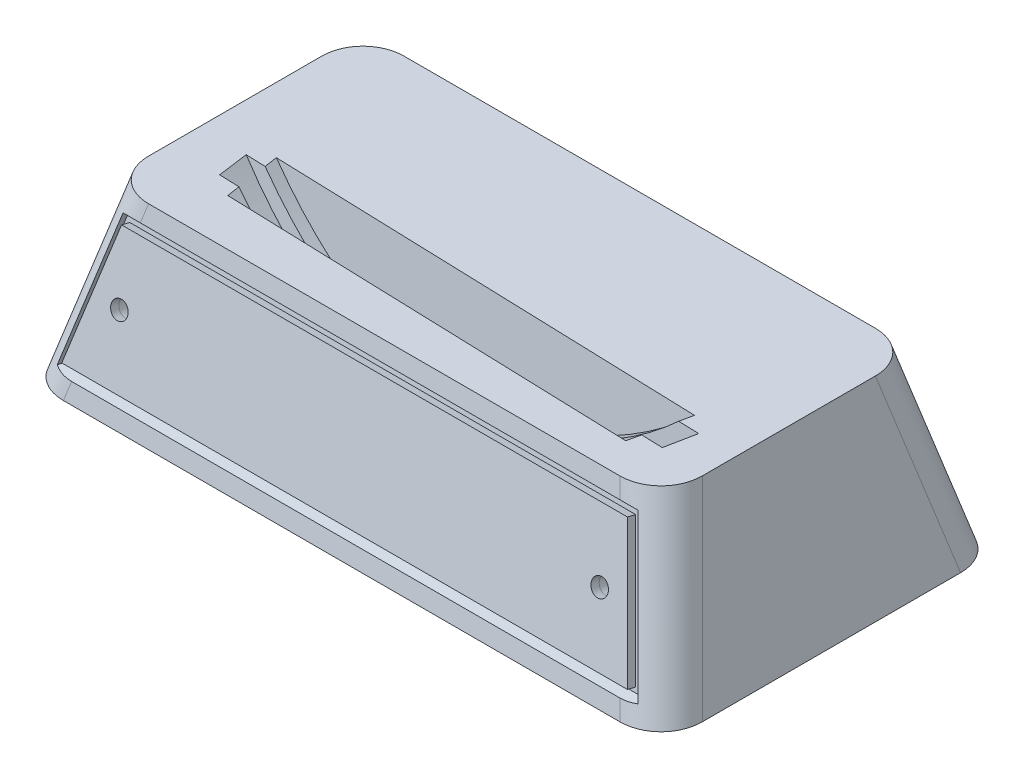
from build123d import *

# Parameters (mm, degrees)
CUT_EXTRUDE8_DEPTH  = 2
CUT_EXTRUDE8_DRAFT  = -30.000000000000068
CAVITY1_START       = -27.005751745
CAVITY1_DEPTH       = 13.13
CAVITY1_START_2     = -23.972790864
CAVITY1_2_DEPTH     = 7.07
CUT_EXTRUDE11_DEPTH = 13.980872
CUT_EXTRUDE12_DEPTH = 22.019128
CAVITY2_START       = 8.727473307
CAVITY2_OUTLINE_R   = 1.5
CAVITY2_DEPTH       = 10.107211823
BOSS_EXTRUDE1_DEPTH = 2
FILLET1_R           = 10
SKETCH14_R          = 2.0000000000000027
CUT_EXTRUDE16_DEPTH = 10


with BuildPart() as part:
    # Sketch2 → Loft1 section 0
    with BuildSketch(Plane(origin=(0, 40, 0), x_dir=(1, 0, 0), z_dir=(0, 1, 0))):
        with BuildLine():
            Line((-64.99999999999999, 30), (-64.99999999999999, -30))
            Line((-64.99999999999999, -30), (65.00000000000001, -30.000000000000007))
            Line((65.00000000000001, -30.000000000000007), (65.00000000000003, 30))
            Line((65.00000000000003, 30), (-64.99999999999999, 30))
        make_face()
    # Sketch1 → Loft1 section 1
    with BuildSketch(Plane(origin=(0, 0, 0), x_dir=(1, 0, 0), z_dir=(0, 1, 0))):
        with BuildLine():
            Line((-74.99999999999999, 40), (75.00000000000001, 40))
            Line((75.00000000000001, 40), (75.00000000000001, -40))
            Line((75.00000000000001, -40), (-74.99999999999999, -40))
            Line((-74.99999999999999, -40), (-74.99999999999999, 40))
        make_face()
    loft()


with BuildPart() as cut_extrude8_tool:
    # Sketch3 → Cut-Extrude8 (with draft: the straight prism first)
    with BuildSketch(Plane(origin=(0, 9.411764705882353, 37.64705882352941), x_dir=(1, 0, 0), z_dir=(0, 0.24253562503633302, 0.9701425001453319))):
        Polygon((-69.91389145643446, -5.701425001453311), (68.34097968479703, -5.701425001453311), (60.2812646850877, 27.529631254723288), (-61.85417645672512, 27.529631254723288), align=None)
    extrude(amount=-CUT_EXTRUDE8_DEPTH)
    # Cut-Extrude8: the draft: its side faces are tilted about the plane it starts from
    cut_extrude8_sides = [cut_extrude8_tool.faces().sort_by_distance(p)[0] for p in [
        (-0.786455886, 3.638034376, 38.059715),
        (64.311122185, 19.757464375, 34.0298575),
        (-0.786455886, 35.876894374, 30),
        (-65.884033957, 19.757464375, 34.0298575),
    ]]
    draft(cut_extrude8_sides, Plane(origin=(0, 9.411764705882353, 37.64705882352941), x_dir=(1, 0, 0), z_dir=(0, 0.24253562503633302, 0.9701425001453319)), CUT_EXTRUDE8_DRAFT)


with BuildPart() as part_1:
    add(part.part)

    # Cut-Extrude8: cut by cut_extrude8_tool
    add(cut_extrude8_tool.part, mode=Mode.SUBTRACT)

    # Cavity1: read off the stored shape, not the designer's step
    # Cavity1 outline → Cavity1 (cut)
    with BuildSketch(Plane(origin=(0, 0, 0), x_dir=(0.9994854140769153, 0.005403413308691594, 0.03161819368833113), z_dir=(0.032076580982039964, -0.16836684655668904, -0.9852023639501983)).offset(CAVITY1_START)):
        with BuildLine():
            add(Edge.make_bspline(
                [(50.355235298, -36.209129734), (50.805312989652776, -36.60371201438724), (51.24948658178987, -37.00382899801401), (51.687403264, -37.409437974)],
                knots=[0.11211566120277261, 0.11211566120277261, 0.11211566120277261, 0.11211566120277261, 0.1192150960387556, 0.1192150960387556, 0.1192150960387556, 0.1192150960387556], degree=3))
            add(Edge.make_bspline(
                [(49.761044253, -35.694333688), (49.96021870095069, -35.864870240989205), (50.158292235749954, -36.036470115873016), (50.355235298, -36.209129734)],
                knots=[0.10900912101711563, 0.10900912101711563, 0.10900912101711563, 0.10900912101711563, 0.11211566120248272, 0.11211566120248272, 0.11211566120248272, 0.11211566120248272], degree=3))
            Line((49.761044253, -35.694333688), (-46.845091182, -36.223904348))
            add(Edge.make_bspline(
                [(-47.417110338, -36.745093263), (-47.22719353968011, -36.57064858623464), (-47.03651846748558, -36.39691770953557), (-46.845091182, -36.223904348)],
                knots=[0.6864352775247219, 0.6864352775247219, 0.6864352775247219, 0.6864352775247219, 0.6894561696163187, 0.6894561696163187, 0.6894561696163187, 0.6894561696163187], degree=3))
            add(Edge.make_bspline(
                [(-48.715193267, -37.959819881), (-48.28655788769419, -37.55116650190169), (-47.853839012104416, -37.14624257172727), (-47.417110338, -36.745093263)],
                knots=[0.6794884976438031, 0.6794884976438031, 0.6794884976438031, 0.6794884976438031, 0.6864352775247208, 0.6864352775247208, 0.6864352775247208, 0.6864352775247208], degree=3))
            add(Edge.make_bspline(
                [(-49.256344045, -38.4798281), (-49.07669321747152, -38.3058284511273), (-48.89630777162405, -38.1324912420223), (-48.715193267, -37.959819881)],
                knots=[0.6765532229119626, 0.6765532229119626, 0.6765532229119626, 0.6765532229119626, 0.6794884976438018, 0.6794884976438018, 0.6794884976438018, 0.6794884976438018], degree=3))
            Line((-49.256344045, -38.4798281), (52.235908996, -37.92347297))
            add(Edge.make_bspline(
                [(51.687403264, -37.409437974), (51.87135121860002, -37.57981499870691), (52.05419517867322, -37.751161052615934), (52.235908996, -37.92347297)],
                knots=[0.11921509604045627, 0.11921509604045627, 0.11921509604045627, 0.11921509604045627, 0.12219723070068893, 0.12219723070068893, 0.12219723070068893, 0.12219723070068893], degree=3))
        make_face()
        with BuildLine():
            Line((-46.845091182, -36.223904348), (49.761044253, -35.694333688))
            add(Edge.make_bspline(
                [(25.992562022, -21.789918914), (27.97241774927912, -22.554509718421677), (31.86147330768567, -24.21157111866771), (39.53560235227695, -28.149479207087097), (45.484692945993835, -32.12546362556011), (49.27067858554398, -35.27447425551093), (49.761044253, -35.694333688)],
                knots=[0.00014231695830879, 0.00014231695830879, 0.00014231695830879, 0.00014231695830879, 0.0254469495955715, 0.0507515822328341, 0.101360847507359, 0.10900912101711563, 0.10900912101711563, 0.10900912101711563, 0.10900912101711563], degree=3))
            add(Edge.make_bspline(
                [(-46.845091182, -36.223904348), (-46.417616962089184, -35.837550063290415), (-42.751252764049724, -32.583109122216364), (-35.3485175182261, -26.949503677086305), (-25.880244562699968, -21.801451670333996), (-17.951241239258827, -18.93979547800609), (-9.812820325211526, -17.037792218072678), (0.8369249515851553, -16.406292550348134), (11.588276700291972, -17.743375586597505), (19.969053301580413, -19.783463884974942), (23.99478785870199, -21.07345105396366), (25.992562022, -21.789918914)],
                knots=[0.6894561696163187, 0.6894561696163187, 0.6894561696163187, 0.6894561696163187, 0.696202091394543, 0.746811356669069, 0.797420621943594, 0.822725254580857, 0.84802988721812, 0.898639152492646, 0.949248417767171, 0.974553050404434, 0.999857683041697, 0.999857683041697, 0.999857683041697, 0.999857683041697], degree=3))
        make_face()
    extrude(amount=CAVITY1_DEPTH, mode=Mode.SUBTRACT)

    # Cavity1 2 outline → Cavity1 2 (cut)
    with BuildSketch(Plane(origin=(0, 0, 0), x_dir=(0.9994854140769153, 0.005403413308691594, 0.03161819368833113), z_dir=(0.032076580982039964, -0.16836684655668904, -0.9852023639501983)).offset(CAVITY1_START_2)):
        with BuildLine():
            add(Edge.make_bspline(
                [(27.191342809, -18.550931312), (37.35377153585318, -22.470993201582978), (47.403872591056825, -28.360509477424444), (55.347576783, -36.181762968)],
                knots=[0, 0, 0, 0, 0.12686867431457954, 0.12686867431457954, 0.12686867431457954, 0.12686867431457954], degree=3))
            add(Edge.make_bspline(
                [(27.191342809, -18.550931312), (13.674487738389166, -13.697438126784096), (-12.232516906914503, -10.152698462282672), (-38.21904867543959, -24.333826303887037), (-48.959817642205, -33.642555584421366), (-52.107843822, -36.770806684)],
                knots=[0, 0, 0, 0, 0.167280310890927, 0.277652873911495, 0.3281558088454397, 0.3281558088454397, 0.3281558088454397, 0.3281558088454397], degree=3))
            Line((-52.107843822, -36.770806684), (-47.417110338, -36.745093263))
            add(Edge.make_bspline(
                [(-47.417110338, -36.745093263), (-47.22719353968011, -36.57064858623464), (-47.03651846748558, -36.39691770953557), (-46.845091182, -36.223904348)],
                knots=[0.6864352775247219, 0.6864352775247219, 0.6864352775247219, 0.6864352775247219, 0.6894561696163187, 0.6894561696163187, 0.6894561696163187, 0.6894561696163187], degree=3))
            add(Edge.make_bspline(
                [(-46.845091182, -36.223904348), (-46.417616962089184, -35.837550063290415), (-42.751252764049724, -32.583109122216364), (-35.3485175182261, -26.949503677086305), (-25.880244562699968, -21.801451670333996), (-17.951241239258827, -18.93979547800609), (-9.812820325211526, -17.037792218072678), (0.8369249515851553, -16.406292550348134), (11.588276700291972, -17.743375586597505), (19.969053301580413, -19.783463884974942), (23.99478785870199, -21.07345105396366), (25.992562022, -21.789918914)],
                knots=[0.6894561696163187, 0.6894561696163187, 0.6894561696163187, 0.6894561696163187, 0.696202091394543, 0.746811356669069, 0.797420621943594, 0.822725254580857, 0.84802988721812, 0.898639152492646, 0.949248417767171, 0.974553050404434, 0.999857683041697, 0.999857683041697, 0.999857683041697, 0.999857683041697], degree=3))
            add(Edge.make_bspline(
                [(25.992562022, -21.789918914), (27.97241774927912, -22.554509718421677), (31.86147330768567, -24.21157111866771), (39.53560235227695, -28.149479207087097), (45.484692945993835, -32.12546362556011), (49.27067858554398, -35.27447425551093), (49.761044253, -35.694333688)],
                knots=[0.00014231695830879, 0.00014231695830879, 0.00014231695830879, 0.00014231695830879, 0.0254469495955715, 0.0507515822328341, 0.101360847507359, 0.10900912101711563, 0.10900912101711563, 0.10900912101711563, 0.10900912101711563], degree=3))
            add(Edge.make_bspline(
                [(49.761044253, -35.694333688), (49.96021870095069, -35.864870240989205), (50.158292235749954, -36.036470115873016), (50.355235298, -36.209129734)],
                knots=[0.10900912101711563, 0.10900912101711563, 0.10900912101711563, 0.10900912101711563, 0.11211566120248272, 0.11211566120248272, 0.11211566120248272, 0.11211566120248272], degree=3))
            Line((50.355235298, -36.209129734), (55.347576783, -36.181762968))
        make_face()
        with BuildLine():
            add(Edge.make_bspline(
                [(55.347576783, -36.181762968), (55.74919687256925, -36.577192159097784), (56.145432715262274, -36.97755914211079), (56.53602661, -37.382859043)],
                knots=[0.1268686743145864, 0.1268686743145864, 0.1268686743145864, 0.1268686743145864, 0.13328293736502136, 0.13328293736502136, 0.13328293736502136, 0.13328293736502136], degree=3))
            Line((55.347576783, -36.181762968), (50.355235298, -36.209129734))
            add(Edge.make_bspline(
                [(50.355235298, -36.209129734), (50.805312989652776, -36.60371201438724), (51.24948658178987, -37.00382899801401), (51.687403264, -37.409437974)],
                knots=[0.11211566120277261, 0.11211566120277261, 0.11211566120277261, 0.11211566120277261, 0.1192150960387556, 0.1192150960387556, 0.1192150960387556, 0.1192150960387556], degree=3))
            Line((51.687403264, -37.409437974), (56.53602661, -37.382859043))
        make_face()
        with BuildLine():
            Line((-47.417110338, -36.745093263), (-52.107843823, -36.770806685))
            add(Edge.make_bspline(
                [(-52.107843823, -36.770806685), (-52.511739115098145, -37.17216481243256), (-52.91195079030909, -37.57691398832324), (-53.308422277, -37.984998807)],
                knots=[0.3281558088541084, 0.3281558088541084, 0.3281558088541084, 0.3281558088541084, 0.3346353920875178, 0.3346353920875178, 0.3346353920875178, 0.3346353920875178], degree=3))
            Line((-53.308422277, -37.984998807), (-48.715193267, -37.959819881))
            add(Edge.make_bspline(
                [(-48.715193267, -37.959819881), (-48.28655788769419, -37.55116650190169), (-47.853839012104416, -37.14624257172727), (-47.417110338, -36.745093263)],
                knots=[0.6794884976438031, 0.6794884976438031, 0.6794884976438031, 0.6794884976438031, 0.6864352775247208, 0.6864352775247208, 0.6864352775247208, 0.6864352775247208], degree=3))
        make_face()
    extrude(amount=CAVITY1_2_DEPTH, mode=Mode.SUBTRACT)

    # Sketch4 → Cut-Extrude11 (cut)
    with BuildSketch(Plane.XZ):
        Polygon((-64.99999999999999, -30), (65.00000000000003, -30), (65.00000000000001, 30.000000000000007), (-64.99999999999999, 30), align=None)
    extrude(amount=-CUT_EXTRUDE11_DEPTH, mode=Mode.SUBTRACT)

    # Sketch7 → Cut-Extrude12 (cut)
    with BuildSketch(Plane.XZ.offset(-13.980871517386877)):
        Polygon((-60.99999999999998, 1.630963903200694), (61.00000000000003, 1.630963903200694), (61.00000000000003, -26.000000000000007), (-60.999999999999986, -26.000000000000007), align=None)
    extrude(amount=-CUT_EXTRUDE12_DEPTH, mode=Mode.SUBTRACT)

    # Cavity2: read off the stored shape, not the designer's step
    # Cavity2 outline → Cavity2 (cut)
    with BuildSketch(Plane(origin=(0, 0, 0), x_dir=(1, 0, 0), z_dir=(0, 0.9857095962326692, -0.16845353037211303)).offset(CAVITY2_START)):
        with Locations((0, -20.448313278)):
            Circle(CAVITY2_OUTLINE_R)
    extrude(amount=CAVITY2_DEPTH, mode=Mode.SUBTRACT)

    # Fillet1
    # the kernel refuses this fillet: 10 mm, written as the material it takes off along each edge
    with BuildSketch(Plane(origin=(59.44444444444446, 62.222222222222214, 24.444444444444457), x_dir=(0.0571661950475022, -0.2286647801900118, -0.97182531580755), z_dir=(0.23570226039551587, -0.9428090415820635, 0.2357022603955157))) as fillet1_piece_1:
        with BuildLine():
            CenterArc((FILLET1_R * 0.942809041582, -FILLET1_R), FILLET1_R, 90.00000000000004, 86.62771331656596)
            Line((-FILLET1_R * 0.0554593553872, -FILLET1_R * 0.941176470588), (0, 0))
            Line((0, 0), (FILLET1_R * 0.942809041582, -1e-17))
        make_face()
    extrude(amount=89.56685895029601, mode=Mode.SUBTRACT)
    with BuildSketch(Plane(origin=(59.44444444444448, 62.22222222222224, -24.44444444444444), x_dir=(-0.9718253158075503, -0.2286647801900115, -0.05716619504750306), z_dir=(0.23570226039551553, -0.9428090415820635, -0.23570226039551587))) as fillet1_piece_2:
        with BuildLine():
            CenterArc((FILLET1_R * 0.942809041582, -FILLET1_R), FILLET1_R, 89.99999999999999, 86.6277133165661)
            Line((-FILLET1_R * 0.0554593553872, -FILLET1_R * 0.941176470588), (0, 0))
            Line((0, 0), (FILLET1_R * 0.942809041582, -3e-17))
        make_face()
    extrude(amount=89.56685895029607, mode=Mode.SUBTRACT)
    with BuildSketch(Plane(origin=(-59.44444444444442, 62.22222222222225, -24.444444444444436), x_dir=(-0.05716619504750242, -0.22866478019001193, 0.97182531580755), z_dir=(-0.23570226039551584, -0.9428090415820634, -0.23570226039551584))) as fillet1_piece_3:
        with BuildLine():
            CenterArc((FILLET1_R * 0.942809041582, -FILLET1_R), FILLET1_R, 90.00000000000004, 86.62771331656613)
            Line((-FILLET1_R * 0.0554593553872, -FILLET1_R * 0.941176470588), (0, 0))
            Line((0, 0), (FILLET1_R * 0.942809041582, 7e-17))
        make_face()
    extrude(amount=89.56685895029608, mode=Mode.SUBTRACT)
    with BuildSketch(Plane(origin=(-59.44444444444443, 62.22222222222223, 24.444444444444443), x_dir=(-0.05716619504750224, -0.228664780190012, -0.97182531580755), z_dir=(-0.23570226039551584, -0.9428090415820634, 0.23570226039551584))) as fillet1_piece_4:
        with BuildLine():
            CenterArc((FILLET1_R * 0.942809041582, FILLET1_R), FILLET1_R, 183.37228668343386, 86.62771331656609)
            Line((-FILLET1_R * 0.0554593553872, FILLET1_R * 0.941176470588), (0, 0))
            Line((0, 0), (FILLET1_R * 0.942809041582, -1.2e-16))
        make_face()
    extrude(amount=89.56685895029604, mode=Mode.SUBTRACT)


with BuildPart() as body_2:
    # Sketch10 → Boss-Extrude1 (new body)
    with BuildSketch(Plane(origin=(0, 8.926693455809687, 35.706773823238755), x_dir=(1, 0, 0), z_dir=(0, 0.242535625036333, 0.9701425001453319))):
        Polygon((-67.17413125216545, -3.5467244630740566), (65.60121948052803, -3.546724463074049), (58.58668776450257, 25.374930716344036), (-60.15959953614, 25.374930716344014), align=None)
    extrude(amount=BOSS_EXTRUDE1_DEPTH)


with BuildPart() as cut_extrude16_tool:
    # Sketch14 → Cut-Extrude16 (new body)
    with BuildSketch(Plane(origin=(0, 9.411764705882353, 37.64705882352941), x_dir=(1, 0, 0), z_dir=(0, 0.24253562503633302, 0.9701425001453319))):
        with Locations(Location((-57.15959953614, 10.91410312663499, 0), (0, 0, 270))):
            Circle(SKETCH14_R)
        with Locations(Location((55.58668776450257, 10.914103126634998, 0), (0, 0, 270))):
            Circle(SKETCH14_R)
    extrude(amount=-CUT_EXTRUDE16_DEPTH)


with BuildPart() as part_2:
    add(part_1.part)

    # Cut-Extrude16: cut by cut_extrude16_tool
    add(cut_extrude16_tool.part, mode=Mode.SUBTRACT)


with BuildPart() as body_2_1:
    add(body_2.part)

    # Cut-Extrude16: cut by cut_extrude16_tool
    add(cut_extrude16_tool.part, mode=Mode.SUBTRACT)


solid = Compound([part_2.part, body_2_1.part])
